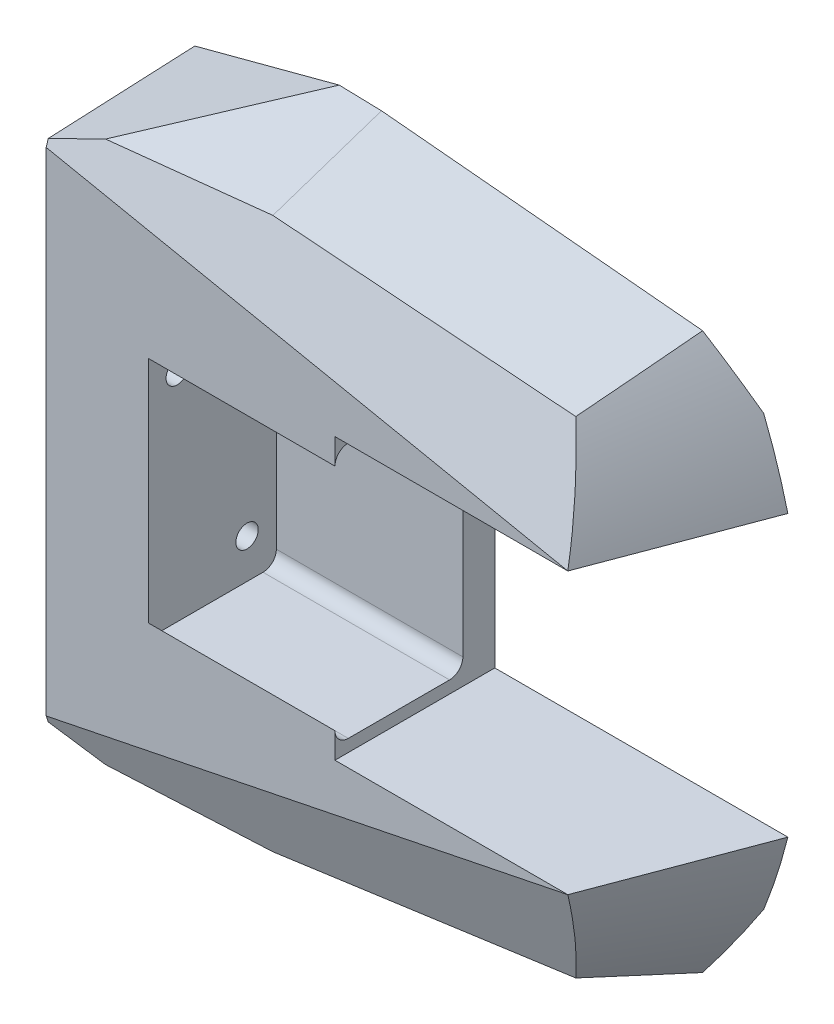
from build123d import *

# Parameters (mm, degrees)
BOSS_EXTRUDE1_DEPTH                             = 30
SKETCH3_W                                       = 30
SKETCH3_H                                       = 52.601373674
CUT_EXTRUDE1_DEPTH                              = 20
DRAFT1_ANGLE                                    = 20
CUT_EXTRUDE2_DEPTH                              = 5
CUT_EXTRUDE3_DEPTH                              = 5
M6X1_0_TAPPED_HOLE1_D                           = 5
M6X1_0_TAPPED_HOLE1_DEPTH                       = 10
M6X1_0_TAPPED_HOLE1_TIP                         = 1.502151548
CUT_REVOLVE1_ANGLE                              = 20
CUT_REVOLVE2_ANGLE                              = 20
CUT_REVOLVE3_ANGLE                              = 20
CUT_REVOLVE4_ANGLE                              = 20
CUT_EXTRUDE4_DEPTH                              = 35
M5X0_8_TAPPED_HOLE1_D                           = 4.2
SKETCH19_W                                      = 47.516094142
SKETCH19_H                                      = 117.781056104
CUT_REVOLVE5_ANGLE                              = 4
CSK_FOR_M5_FLAT_HEAD_MACHINE_SCREW1_D           = 5.5
CSK_FOR_M5_FLAT_HEAD_MACHINE_SCREW1_DEPTH       = 10
CSK_FOR_M5_FLAT_HEAD_MACHINE_SCREW1_CSINK_D     = 10.4
CSK_FOR_M5_FLAT_HEAD_MACHINE_SCREW1_CSINK_ANGLE = 90
CSK_FOR_M5_FLAT_HEAD_MACHINE_SCREW1_TIP         = 1.652366702


with BuildPart() as part:
    # Sketch2 → Boss-Extrude1 (new body)
    with BuildSketch(Plane.XY):
        with BuildLine():
            Line((-41.221662469, 50), (-50, 46.630311934))
            Line((-50, 46.630311934), (-50, -46.630311934))
            Line((-50, -46.630311934), (-41.221662469, -50))
            Line((-41.221662469, -50), (-10.163742616, -50))
            Line((-10.163742616, -50), (43.420662363, -43.420662363))
            ThreePointArc((43.420662363, -43.420662363), (47.113322701, -35.015547326), (50, -26.300686837))
            Line((50, -26.300686837), (26.300686837, -26.300686837))
            Line((26.300686837, -26.300686837), (26.300686837, 26.300686837))
            Line((26.300686837, 26.300686837), (50, 26.300686837))
            ThreePointArc((50, 26.300686837), (47.113322701, 35.015547326), (43.420662363, 43.420662363))
            Line((43.420662363, 43.420662363), (-10.163742616, 50))
            Line((-10.163742616, 50), (-41.221662469, 50))
        make_face()
    extrude(amount=BOSS_EXTRUDE1_DEPTH)

    # Sketch3 → Cut-Extrude1 (cut)
    with BuildSketch(Plane(origin=(26.300686837, 0, 0), x_dir=(0, 0, -1), z_dir=(1, 0, 0))):
        with Locations((-15, 0)):
            Rectangle(SKETCH3_W, SKETCH3_H)
    extrude(amount=-CUT_EXTRUDE1_DEPTH, mode=Mode.SUBTRACT)

    # Draft1
    draft1_faces = [part.faces().sort_by_distance(p)[0] for p in [
        (-25.692702542, 50, 15),
        (16.628459874, 46.710331182, 15),
        (47.113322701, 35.015547326, 15),
        (47.113322701, -35.015547326, 15),
        (-25.692702542, -50, 15),
        (16.628459874, -46.710331182, 15),
    ]]
    draft(draft1_faces, Plane.XY.offset(30), DRAFT1_ANGLE)

    # Sketch5 → Cut-Extrude2 (cut)
    with BuildSketch(Plane.ZY.offset(50)):
        with BuildLine():
            Line((0, 42), (23, 42))
            ThreePointArc((23, 42), (26.535533906, 40.535533906), (28, 37))
            Line((28, 37), (28, -37))
            ThreePointArc((28, -37), (26.535533906, -40.535533906), (23, -42))
            Line((23, -42), (0, -42))
            Line((0, -42), (0, 42))
        make_face()
    extrude(amount=-CUT_EXTRUDE2_DEPTH, mode=Mode.SUBTRACT)

    # Sketch6 → Cut-Extrude3 (cut)
    with BuildSketch(Plane(origin=(0, 0, 0), x_dir=(-1, 0, 0), z_dir=(0, 0, -1))):
        with BuildLine():
            Line((45, 42), (10, 42))
            ThreePointArc((10, 42), (6.464466094, 40.535533906), (5, 37))
            Line((5, 37), (5, -37))
            ThreePointArc((5, -37), (6.464466094, -40.535533906), (10, -42))
            Line((10, -42), (45, -42))
            Line((45, -42), (45, 42))
        make_face()
    extrude(amount=-CUT_EXTRUDE3_DEPTH, mode=Mode.SUBTRACT)

    # M6x1.0 Tapped Hole1
    with Locations(Plane(origin=(0, 0, 5), x_dir=(-1, 0, 0), z_dir=(0, 0, -1))):
        with Locations((29.9, 29.895651858), (29.9, -29.895651858)):
            Hole(M6X1_0_TAPPED_HOLE1_D / 2, depth=M6X1_0_TAPPED_HOLE1_DEPTH)
            with Locations((0, 0, -(M6X1_0_TAPPED_HOLE1_DEPTH + M6X1_0_TAPPED_HOLE1_TIP / 2))):  # 118° drill point
                Cone(0, M6X1_0_TAPPED_HOLE1_D / 2, M6X1_0_TAPPED_HOLE1_TIP, mode=Mode.SUBTRACT)

    # Sketch9 → Cut-Revolve1 (revolve, cut)
    with BuildSketch(Plane(origin=(0, 0, 0), x_dir=(-1, 0, 0), z_dir=(0, 0, -1))):
        with BuildLine():
            Line((50, 46.630311934), (-56.76790933, 40.30398391))
            ThreePointArc((-56.76790933, 40.30398391), (-54.419330105, 48.540812289), (-51.472316128, 56.582968389))
            Line((-51.472316128, 56.582968389), (18.167108014, 64.912852718))
            Line((18.167108014, 64.912852718), (50, 46.630311934))
        make_face()
    revolve(axis=Axis((-50, 46.630311934, 0), (0.9982491449473906, -0.0591493416007627, 0)), revolution_arc=CUT_REVOLVE1_ANGLE, mode=Mode.SUBTRACT)

    # Sketch11 → Cut-Revolve2 (revolve, cut)
    with BuildSketch(Plane(origin=(0, 0, 0), x_dir=(-1, 0, 0), z_dir=(0, 0, -1))):
        with BuildLine():
            Line((50, -46.630311934), (-56.76790933, -40.30398391))
            ThreePointArc((-56.76790933, -40.30398391), (-55.407295575, -48.597993011), (-53.453959647, -56.772730652))
            Line((-53.453959647, -56.772730652), (21.223580117, -65.428953237))
            Line((21.223580117, -65.428953237), (50, -46.630311934))
        make_face()
    revolve(axis=Axis((-50, -46.630311934, 0), (-0.9982491449473906, -0.05914934160076277, 0)), revolution_arc=CUT_REVOLVE2_ANGLE, mode=Mode.SUBTRACT)

    # Sketch13 → Cut-Revolve3 (revolve, cut)
    with BuildSketch(Plane.XY.offset(30)):
        Polygon((-50, 46.630311934), (50, 26.300686837), (49.446951964, 52.159989852), (-50, 58.994858097), align=None)
    revolve(axis=Axis((-50, 46.630311934, 30), (-0.9799545689980745, 0.1992210899975155, 0)), revolution_arc=CUT_REVOLVE3_ANGLE, mode=Mode.SUBTRACT)

    # Sketch14 → Cut-Revolve4 (revolve, cut)
    with BuildSketch(Plane.XY.offset(30)):
        Polygon((50, -26.300686837), (49.446951964, -52.159989852), (-50, -58.995311934), (-50, -46.630311934), align=None)
    revolve(axis=Axis((50, -26.300686837, 30), (0.9799545689980745, 0.1992210899975155, 0)), revolution_arc=CUT_REVOLVE4_ANGLE, mode=Mode.SUBTRACT)

    # Sketch15 → Cut-Extrude4 (cut)
    with BuildSketch(Plane(origin=(6.300686837, 0, 0), x_dir=(0, 0, -1), z_dir=(1, 0, 0))):
        with BuildLine():
            Line((-30, 0), (-30, -21.5))
            ThreePointArc((-30, -21.5), (-29.267766953, -23.267766953), (-27.5, -24))
            Line((-27.5, -24), (-8.5, -24))
            ThreePointArc((-8.5, -24), (-6.732233047, -23.267766953), (-6, -21.5))
            Line((-6, -21.5), (-6, 21.5))
            ThreePointArc((-6, 21.5), (-6.732233047, 23.267766953), (-8.5, 24))
            Line((-8.5, 24), (-27.5, 24))
            ThreePointArc((-27.5, 24), (-29.267766953, 23.267766953), (-30, 21.5))
            Line((-30, 21.5), (-30, 0))
        make_face()
    extrude(amount=-CUT_EXTRUDE4_DEPTH, mode=Mode.SUBTRACT)

    # M5x0.8 Tapped Hole1 (through all)
    with Locations(Plane(origin=(-28.699313163, 0, 0), x_dir=(0, 0, -1), z_dir=(1, 0, 0))):
        with Locations((-11.497988924, -16.605361405), (-24.602011076, 16.605361405)):
            Hole(M5X0_8_TAPPED_HOLE1_D / 2)

    # Sketch19 → Cut-Revolve5 (revolve, cut)
    with BuildSketch(Plane.ZY.offset(50)):
        with Locations((23.758047071, 0)):
            Rectangle(SKETCH19_W, SKETCH19_H)
    revolve(axis=Axis((-50, 58.890528052, 0), (0, 1, 0)), revolution_arc=CUT_REVOLVE5_ANGLE, mode=Mode.SUBTRACT)

    # CSK for M5 Flat Head Machine Screw1
    with Locations(Plane(origin=(0, 0, 0), x_dir=(-1, 0, 0), z_dir=(0, 0, -1))):
        with Locations((-50.268656574, 33.379143774), (-50.268656574, -33.379143774), (-36.268656574, -33.379143774), (-22.268656574, -33.379143774), (-36.268656574, 33.379143774), (-22.268656574, 33.379143774)):
            CounterSinkHole(CSK_FOR_M5_FLAT_HEAD_MACHINE_SCREW1_D / 2, CSK_FOR_M5_FLAT_HEAD_MACHINE_SCREW1_CSINK_D / 2, depth=CSK_FOR_M5_FLAT_HEAD_MACHINE_SCREW1_DEPTH, counter_sink_angle=CSK_FOR_M5_FLAT_HEAD_MACHINE_SCREW1_CSINK_ANGLE)
            with Locations((0, 0, -(CSK_FOR_M5_FLAT_HEAD_MACHINE_SCREW1_DEPTH + CSK_FOR_M5_FLAT_HEAD_MACHINE_SCREW1_TIP / 2))):  # 118° drill point
                Cone(0, CSK_FOR_M5_FLAT_HEAD_MACHINE_SCREW1_D / 2, CSK_FOR_M5_FLAT_HEAD_MACHINE_SCREW1_TIP, mode=Mode.SUBTRACT)


solid = part.part
